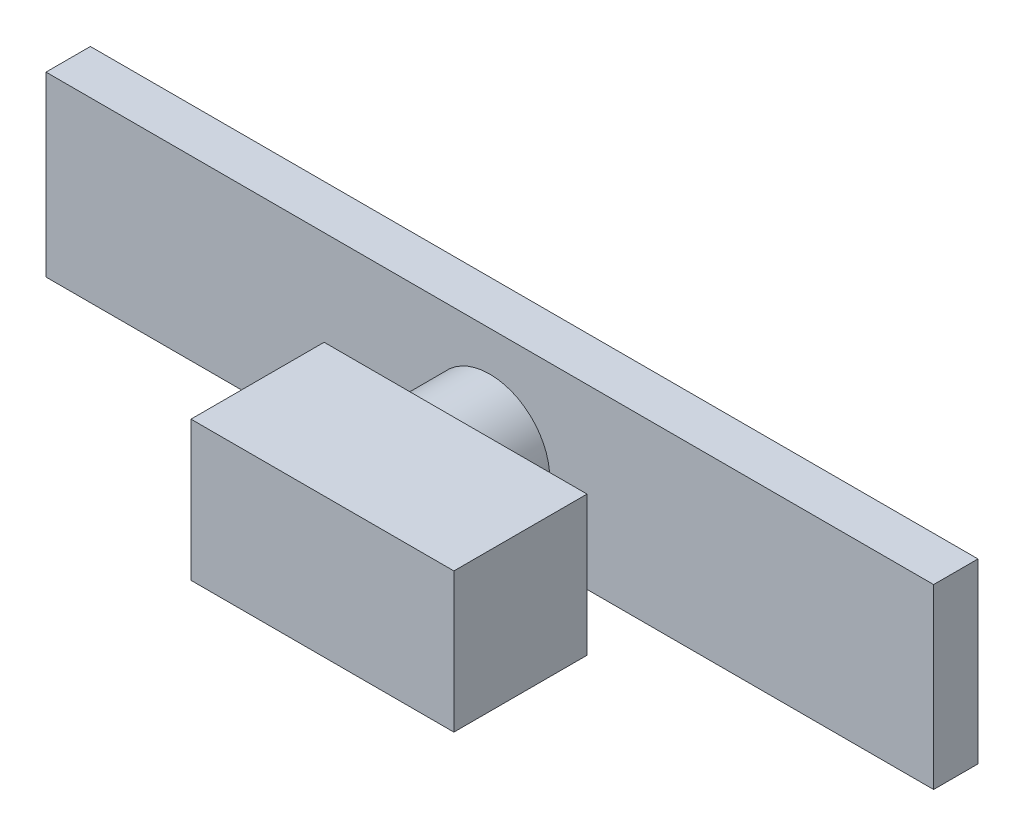
from build123d import *

# Parameters (mm, degrees)
SKETCH2_W             = 254
SKETCH2_H             = 12.7
BOSS_EXTRUDE1_DEPTH   = 50.8
SKETCH3_R             = 17.140791438
BOSS_EXTRUDE2_DEPTH   = 19.05
SKETCH4_W             = 75.235944222
SKETCH4_H             = 39.955088207
BOSS_EXTRUDE3_DEPTH   = 38.1
SCALE2_SCALE          = 0.06
BODY_MOVE_COPY1_ANGLE = 90
SCALE5_SCALE          = 0.25


with BuildPart() as part:
    # Sketch2 → Boss-Extrude1 (new body)
    with BuildSketch(Plane.XY):
        with Locations((79.130769231, 14.898076923)):
            Rectangle(SKETCH2_W, SKETCH2_H)
    extrude(amount=BOSS_EXTRUDE1_DEPTH)

    # Sketch3 → Boss-Extrude2 (add)
    with BuildSketch(Plane(origin=(0, 21.248076923, 0), x_dir=(1, 0, 0), z_dir=(0, 1, 0))):
        with Locations((79.130769231, -28.483063876)):
            Circle(SKETCH3_R)
    extrude(amount=BOSS_EXTRUDE2_DEPTH)

    # Sketch4 → Boss-Extrude3 (add)
    with BuildSketch(Plane(origin=(0, 40.298076923, 0), x_dir=(1, 0, 0), z_dir=(0, 1, 0))):
        with Locations((88.38546847, -28.088530296)):
            Rectangle(SKETCH4_W, SKETCH4_H)
    extrude(amount=BOSS_EXTRUDE3_DEPTH)


with BuildPart() as part_1:
    # Scale2: scaled about (82.711857342, 33.041003565, 26.623476887)
    add(part.part.scale(SCALE2_SCALE).moved(Location((77.749145901, 31.058543351, 25.026068274))))


with BuildPart() as part_2:
    # Body-Move/Copy1: moved
    add(part_1.part.rotate(Axis((0, 33.666927966, 26.550068274), (1, 0, 0)), BODY_MOVE_COPY1_ANGLE))


with BuildPart() as part_3:
    # Body-Move/Copy3: moved
    add(part_2.part.moved(Location((-50.8, 0, -50.8))))


with BuildPart() as part_4:
    # Scale5: scaled about (31.911857342, 33.593519353, -24.875856127)
    add(part_3.part.scale(SCALE5_SCALE).moved(Location((23.933893006, 25.195139515, -18.656892095))))


with BuildPart() as part_5:
    # Body-Move/Copy9: moved
    add(part_4.part.moved(Location((-50.8, 0, 0))))


with BuildPart() as part_6:
    # Body-Move/Copy13: moved
    add(part_5.part.moved(Location((0, -50.8, 0))))


solid = part_6.part
